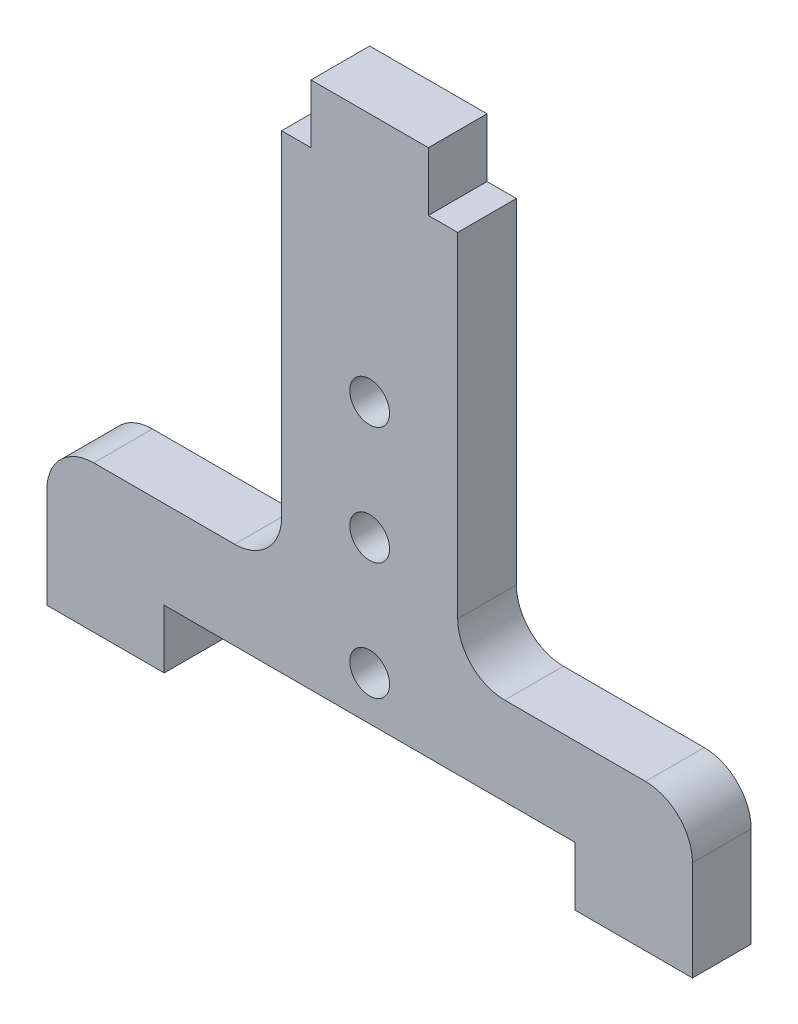
from build123d import *

# Parameters (mm, degrees)
SKETCH1_W             = 69.85
SKETCH1_H             = 50.8
BASE_DEPTH            = 6.35
SKETCH6_W             = 12.7
SKETCH6_H             = 6.35
BOSS_EXTRUDE1_DEPTH   = 6.35
SKETCH7_W             = 25.4
SKETCH7_H             = 41.275
CUT_EXTRUDE1_DEPTH    = 48.625
F_8_CLEARANCE_HOLE1_D = 4.3053
SKETCH8_W             = 25.4
SKETCH8_H             = 41.275
CUT_EXTRUDE2_DEPTH    = 48.625
FILLET1_R             = 5.08


with BuildPart() as part:
    # Sketch1 → Base (new body)
    with BuildSketch(Plane.XY):
        Rectangle(SKETCH1_W, SKETCH1_H)
    extrude(amount=BASE_DEPTH)

    # Sketch6 → Boss-Extrude1 (add)
    with BuildSketch(Plane.XY.offset(6.35)):
        with Locations((0, 28.575)):
            Rectangle(SKETCH6_W, SKETCH6_H)
        with Locations((28.575, -28.575)):
            Rectangle(SKETCH6_W, SKETCH6_H)
        with Locations((-28.575, -28.575)):
            Rectangle(SKETCH6_W, SKETCH6_H)
    extrude(amount=-BOSS_EXTRUDE1_DEPTH)

    # Sketch7 → Cut-Extrude1 (cut, through all)
    with BuildSketch(Plane.XY.offset(6.35)):
        with Locations((-22.225, 4.7625)):
            Rectangle(SKETCH7_W, SKETCH7_H)
    extrude(amount=-CUT_EXTRUDE1_DEPTH, mode=Mode.SUBTRACT)

    # #8 Clearance Hole1 (through all)
    with Locations(Plane(origin=(0, 0, 0), x_dir=(-1, 0, 0), z_dir=(0, 0, -1))):
        with Locations((0, -20.6375), (0, -7.9375), (0, 4.7625)):
            Hole(F_8_CLEARANCE_HOLE1_D / 2)

    # Sketch8 → Cut-Extrude2 (cut, through all)
    with BuildSketch(Plane.XY.offset(6.35)):
        with Locations((22.225, 4.7625)):
            Rectangle(SKETCH8_W, SKETCH8_H)
    extrude(amount=-CUT_EXTRUDE2_DEPTH, mode=Mode.SUBTRACT)

    # Fillet1
    fillet1_edges = [part.edges().sort_by_distance(p)[0] for p in [
        (9.525, -15.875, 3.175),
        (34.925, -15.875, 3.175),
        (-34.925, -15.875, 3.175),
        (-9.525, -15.875, 3.175),
    ]]
    fillet(fillet1_edges, radius=FILLET1_R)


solid = part.part
